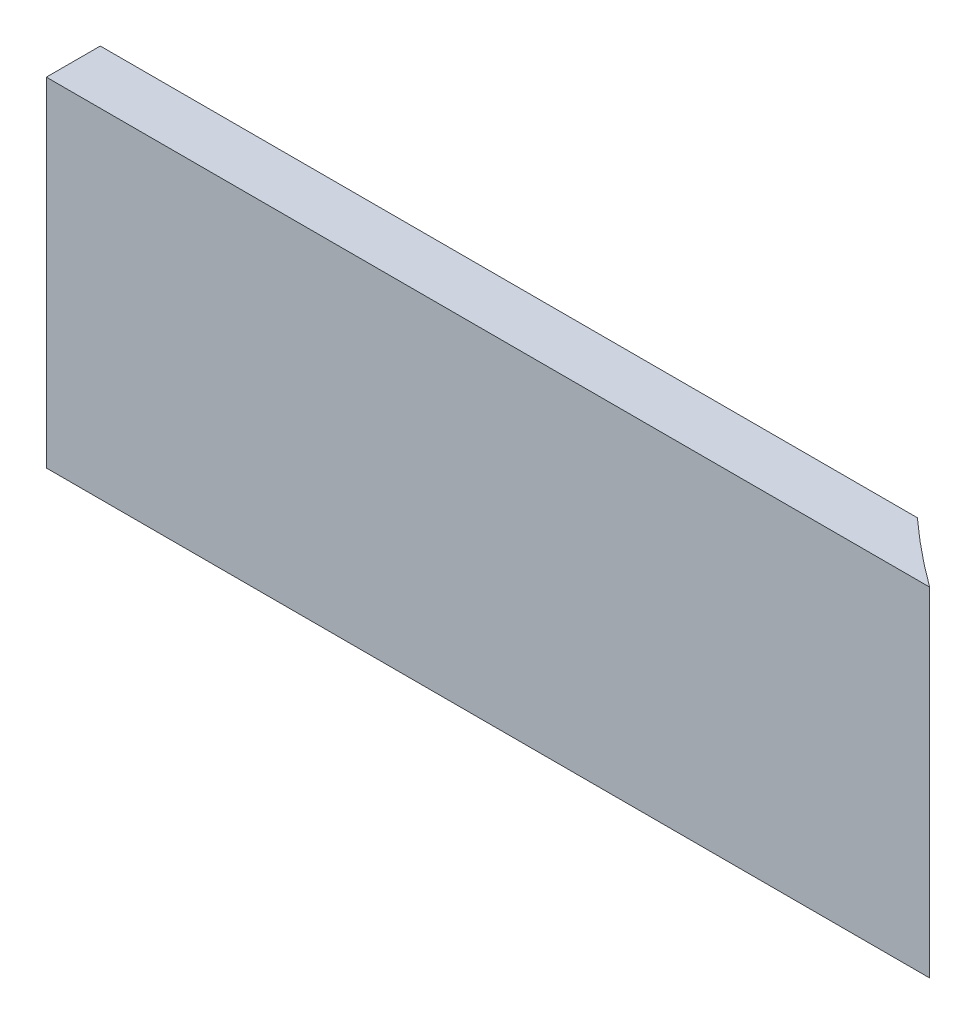
from build123d import *

# Parameters (mm, degrees)
SKETCH1_W           = 595
SKETCH1_H           = 210
BOSS_EXTRUDE1_DEPTH = 33.45
CAVITY3_START       = -105
CAVITY3_DEPTH       = 210


# Read off the part's stored shape, not the designer's step: Cavity3
with BuildPart() as part:
    # Sketch1 → Boss-Extrude1 (new body)
    with BuildSketch(Plane.XY):
        Rectangle(SKETCH1_W, SKETCH1_H)
    extrude(amount=BOSS_EXTRUDE1_DEPTH)

    # Cavity3 outline → Cavity3 (cut)
    with BuildSketch(Plane(origin=(0, 0, 0), x_dir=(1, 0, 0), z_dir=(0, 1, 0)).offset(CAVITY3_START)):
        with BuildLine():
            Line((297.5, 0), (209.376661417, 0))
            ThreePointArc((209.376661417, 0), (229.447621493, -17.287644513), (250.435340671, -33.45))
            Line((250.435340671, -33.45), (297.5, -33.45))
            Line((297.5, -33.45), (297.5, 0))
        make_face()
    extrude(amount=CAVITY3_DEPTH, mode=Mode.SUBTRACT)


solid = part.part
